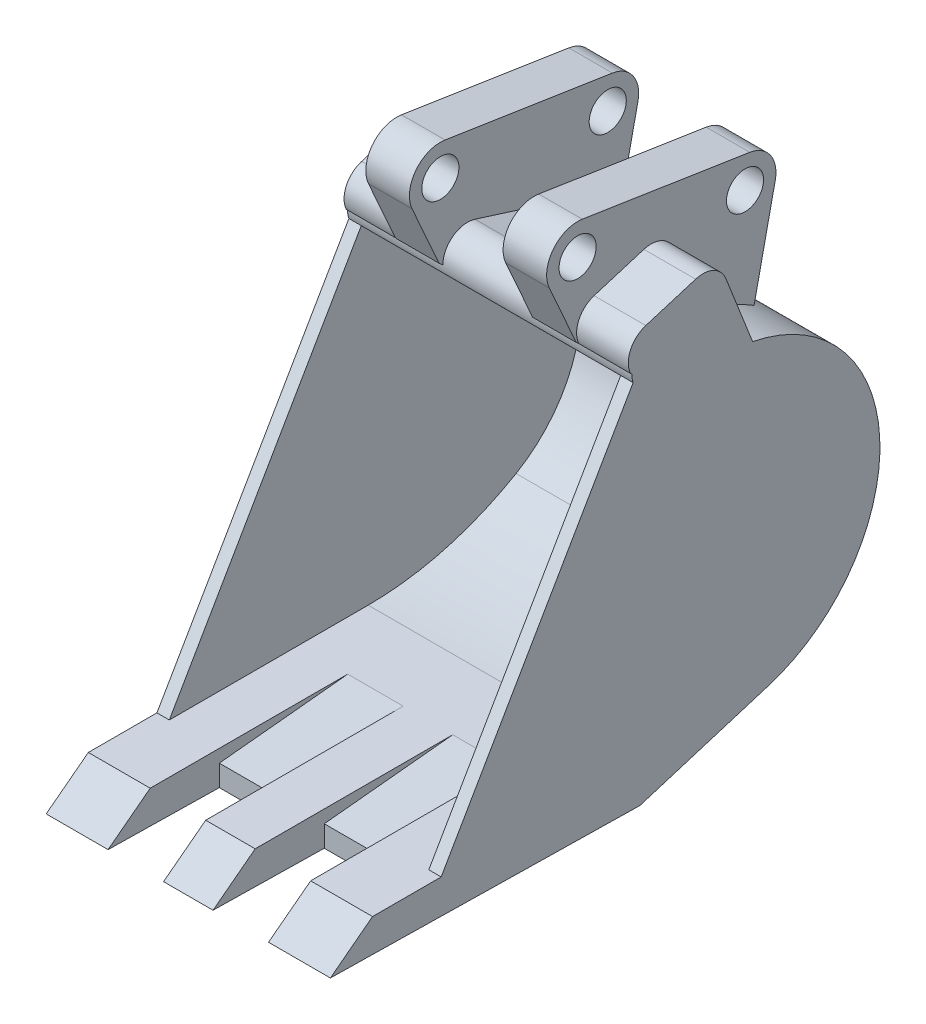
from build123d import *
from build123d.topology import SkipClean

# Parameters (mm, degrees)
BOSS_EXTRUDE1_DEPTH   = 9.600009513678287
BOSS_EXTRUDE2_DEPTH   = 514.3999904863157
CUT_EXTRUDE1_DEPTH    = 199.99999999999986
CUT_EXTRUDE2_DEPTH    = 224.00000000000003
BOSS_EXTRUDE3_DEPTH   = 100.00000000000634
BOSS_EXTRUDE4_DEPTH   = 223.9999999999994
BOSS_EXTRUDE5_DEPTH   = 41.20000000000044
CUT_EXTRUDE3_DEPTH    = 158.79999999999976
BOSS_EXTRUDE6_DEPTH   = 149.19999048631087
CUT_EXTRUDE4_DEPTH    = 378.3999999999982
BOSS_EXTRUDE7_DEPTH   = 9.600009513685004
BOSS_EXTRUDE8_DEPTH   = 49.99999999999939
BOSS_EXTRUDE9_DEPTH   = 279.08274569611746
BOSS_EXTRUDE10_START  = 50.00000000000021
BOSS_EXTRUDE10_DEPTH  = 50.00000000000021
DRAFT1_START          = -793
DRAFT1_DEPTH          = 1150
DRAFT1_START_2        = -791.766847587
DRAFT1_2_DEPTH        = 1148
DRAFT2_ANGLE          = 52.67292498717598
HOLE1_AT_2_COUNT      = 2
HOLE1_AT_2_PITCH      = 684.016470632103
HOLE2_D               = 150
HOLE2_DEPTH           = 384.8
FILLET1_R             = 100.00000000000001
FILLET2_R             = 125
FILLET3_R             = 300
BODY_MOVE_COPY3_ANGLE = 90.0000000000002
BODY_MOVE_COPY4_ANGLE = 120.00000000000021


with BuildPart() as part:
    # Sketch1 → Boss-Extrude1 (new body)
    with BuildSketch(Plane.XY.offset(306.2331524125839)):
        with BuildLine():
            Line((53.08147760316467, -1766.447394034807), (-1027.2936921096916, -1766.4473940348073))
            Line((-1027.2936921096916, -1766.4473940348073), (-1027.2936921096916, -1904.0857327222143))
            Line((-1027.2936921096916, -1904.0857327222143), (98.25366379894766, -1904.0857327222143))
            Line((98.25366379894766, -1904.0857327222143), (571.5107857447487, -1758.657947920252))
            ThreePointArc((571.5107857447487, -1758.657947920252), (1016.6806746482655, -1231.839040201803), (722.5590166804343, -607.9745983313888))
            Line((722.5590166804343, -607.9745983313888), (836.1992361834356, -83.77870158177328))
            Line((836.1992361834356, -83.77870158177328), (28.832182943648764, 40.41985585796329))
            ThreePointArc((28.832182943648764, 40.41985585796329), (-89.48849099605702, -7.222499827583533), (-104.39684181466816, -133.9005050719176))
            Line((-104.39684181466816, -133.9005050719176), (4.335247948888093, -378.51123875566793))
            Line((4.335247948888093, -378.51123875566793), (19.856318658240184, -392.340008322466))
            ThreePointArc((19.856318658240184, -392.340008322466), (21.14387371916233, -408.89399605142665), (25.152813367140993, -425.0067459925245))
            Line((25.152813367140993, -425.0067459925245), (25.121496409919185, -425.06093181631854))
            Line((25.121496409919185, -425.06093181631854), (632.4957363404607, -682.8760006812848))
            ThreePointArc((632.4957363404607, -682.8760006812848), (912.0062760274534, -1138.4665882307247), (650.5429820351718, -1604.6488177874323))
            ThreePointArc((650.5429820351718, -1604.6488177874323), (362.57260370932397, -1725.2821339957313), (53.08147760316467, -1766.447394034807))
        make_face()
    extrude(amount=-BOSS_EXTRUDE1_DEPTH)

    # Sketch2 → Boss-Extrude2 (add)
    with SkipClean():  # the faces are left unmerged after this step: merging them gives an invalid solid
        with BuildSketch(Plane(origin=(0, 0, 296.6331428989056), x_dir=(-1, 0, 0), z_dir=(0, 0, -1))):
            with BuildLine():
                Line((-53.08147763303338, -1766.4473939156126), (1027.293692098456, -1766.4473939156126))
                Line((1027.293692098456, -1766.4473939156126), (1027.293692098456, -1904.0857326059793))
                Line((1027.293692098456, -1904.0857326059793), (-98.2536638101782, -1904.0857326059797))
                Line((-98.2536638101782, -1904.0857326059797), (-571.5107857559829, -1758.6579478040192))
                ThreePointArc((-571.5107857559829, -1758.6579478040192), (-1016.6806746151524, -1231.8390401398947), (-722.5590166804387, -607.9745983313868))
                Line((-722.5590166804387, -607.9745983313868), (-836.1992361834398, -83.77870158177345))
                Line((-836.1992361834398, -83.77870158177345), (-28.832182943652366, 40.41985585796323))
                ThreePointArc((-28.832182943652366, 40.41985585796323), (89.4884909960535, -7.222499827583732), (104.39684181466478, -133.90050507191813))
                Line((104.39684181466478, -133.90050507191813), (-4.335247948891731, -378.51123875566793))
                Line((-4.335247948891731, -378.51123875566793), (-19.856318658241946, -392.340008322466))
                ThreePointArc((-19.856318658241946, -392.340008322466), (-21.14387371916395, -408.8939960514259), (-25.152813367143864, -425.0067459925226))
                Line((-25.152813367143864, -425.0067459925226), (-25.121496409920812, -425.0609318163162))
                Line((-25.121496409920812, -425.0609318163162), (-632.4957363404753, -682.8760006812888))
                ThreePointArc((-632.4957363404753, -682.8760006812888), (-912.0062759939467, -1138.4665881761014), (-650.5429820330173, -1604.6488176769096))
                ThreePointArc((-650.5429820330173, -1604.6488176769096), (-362.57260372260464, -1725.282133878744), (-53.08147763303338, -1766.4473939156126))
            make_face()
        extrude(amount=BOSS_EXTRUDE2_DEPTH)

    # Sketch3 → Cut-Extrude1 (cut)
    with SkipClean():  # the faces are left unmerged after this step: merging them gives an invalid solid
        with BuildSketch(Plane.XY.offset(306.2331524125839)):
            Polygon((-1027.29369209846, -1904.085732605916), (-748.21094640232, -1904.0857326059318), (-748.2109464023167, -1766.44739383907), (-1027.2936920984598, -1766.4473938390806), align=None)
        extrude(amount=-CUT_EXTRUDE1_DEPTH, mode=Mode.SUBTRACT)

    # Sketch4 → Cut-Extrude2 (cut)
    with SkipClean():  # the faces are left unmerged after this step: merging them gives an invalid solid
        with BuildSketch(Plane.XY.offset(106.23315241258402)):
            Polygon((-229.4181464023195, -1766.4473938390802), (-1027.2936920984598, -1766.4473938390806), (-1027.29369209846, -1904.085732605916), (-748.21094640232, -1904.0857326059318), (-748.2109464023184, -1818.3266738390705), align=None)
        extrude(amount=-CUT_EXTRUDE2_DEPTH, mode=Mode.SUBTRACT)

    # Sketch5 → Boss-Extrude3 (add)
    with BuildSketch(Plane(origin=(0, 0, -217.7668475874101), x_dir=(-1, 0, 0), z_dir=(0, 0, -1))):
        with BuildLine():
            Line((-53.081477633029785, -1766.4473939156126), (1027.2936920984594, -1766.4473939156126))
            Line((1027.2936920984594, -1766.4473939156126), (1027.2936920984594, -1904.0857326059793))
            Line((1027.2936920984594, -1904.0857326059793), (-98.2536638101746, -1904.0857326059797))
            Line((-98.2536638101746, -1904.0857326059797), (-571.5107857559792, -1758.6579478040192))
            ThreePointArc((-571.5107857559792, -1758.6579478040192), (-1016.6806746151486, -1231.8390401398945), (-722.5590166804352, -607.9745983313868))
            Line((-722.5590166804352, -607.9745983313868), (-836.1992361834363, -83.77870158177345))
            Line((-836.1992361834363, -83.77870158177345), (-28.832182943648775, 40.41985585796323))
            ThreePointArc((-28.832182943648775, 40.41985585796323), (89.4884909960571, -7.222499827583732), (104.39684181466838, -133.90050507191813))
            Line((104.39684181466838, -133.90050507191813), (-4.3352479488881395, -378.51123875566793))
            Line((-4.3352479488881395, -378.51123875566793), (-19.856318658238703, -392.340008322466))
            ThreePointArc((-19.856318658238703, -392.340008322466), (-21.14387371916071, -408.89399605142586), (-25.152813367140272, -425.0067459925226))
            Line((-25.152813367140272, -425.0067459925226), (-25.12149640991722, -425.0609318163162))
            Line((-25.12149640991722, -425.0609318163162), (-632.4957363404717, -682.8760006812888))
            ThreePointArc((-632.4957363404717, -682.8760006812888), (-912.0062759939432, -1138.4665881761014), (-650.5429820330137, -1604.6488176769096))
            ThreePointArc((-650.5429820330137, -1604.6488176769096), (-362.57260372260106, -1725.282133878744), (-53.081477633029785, -1766.4473939156126))
        make_face()
    extrude(amount=BOSS_EXTRUDE3_DEPTH)

    # Sketch6 → Boss-Extrude4 (add)
    with SkipClean():  # the faces are left unmerged after this step: merging them gives an invalid solid
        with BuildSketch(Plane(origin=(0, 0, -317.76684758741646), x_dir=(-1, 0, 0), z_dir=(0, 0, -1))):
            with BuildLine():
                Line((-53.081477633029195, -1766.4473939156128), (229.4181463204047, -1766.4473939156128))
                Line((229.4181463204047, -1766.4473939156128), (748.2109463203855, -1818.3266739156131))
                Line((748.2109463203855, -1818.3266739156131), (748.2109463203855, -1904.0857326059795))
                Line((748.2109463203855, -1904.0857326059795), (-98.2536638101739, -1904.0857326059797))
                Line((-98.2536638101739, -1904.0857326059797), (-571.5107857559785, -1758.6579478040192))
                ThreePointArc((-571.5107857559785, -1758.6579478040192), (-1016.6806746151481, -1231.8390401398947), (-722.5590166804345, -607.9745983313868))
                Line((-722.5590166804345, -607.9745983313868), (-836.1992361834356, -83.77870158177345))
                Line((-836.1992361834356, -83.77870158177345), (-28.83218294364808, 40.41985585796323))
                ThreePointArc((-28.83218294364808, 40.41985585796323), (89.48849099605779, -7.222499827583732), (104.39684181466907, -133.90050507191813))
                Line((104.39684181466907, -133.90050507191813), (-4.335247948887441, -378.51123875566793))
                Line((-4.335247948887441, -378.51123875566793), (-19.856318658238788, -392.340008322466))
                ThreePointArc((-19.856318658238788, -392.340008322466), (-21.14387371916078, -408.89399605142575), (-25.152813367139576, -425.0067459925226))
                Line((-25.152813367139576, -425.0067459925226), (-25.121496409916524, -425.0609318163162))
                Line((-25.121496409916524, -425.0609318163162), (-632.4957363404711, -682.8760006812888))
                ThreePointArc((-632.4957363404711, -682.8760006812888), (-912.0062759939424, -1138.4665881761016), (-650.5429820330128, -1604.6488176769099))
                ThreePointArc((-650.5429820330128, -1604.6488176769099), (-362.5726037226002, -1725.282133878744), (-53.081477633029195, -1766.4473939156128))
            make_face()
        extrude(amount=BOSS_EXTRUDE4_DEPTH)

    # Sketch7 → Boss-Extrude5 (add)
    with BuildSketch(Plane(origin=(0, 0, -541.7668475874159), x_dir=(-1, 0, 0), z_dir=(0, 0, -1))):
        with BuildLine():
            Line((-722.5590166804329, -607.9745983313868), (-836.1992361834341, -83.77870158177345))
            Line((-836.1992361834341, -83.77870158177345), (-28.83218294364651, 40.41985585796323))
            ThreePointArc((-28.83218294364651, 40.41985585796323), (89.48849099605935, -7.222499827583732), (104.39684181467064, -133.90050507191813))
            Line((104.39684181467064, -133.90050507191813), (-4.335247948885877, -378.51123875566793))
            Line((-4.335247948885877, -378.51123875566793), (-19.856318658237367, -392.340008322466))
            ThreePointArc((-19.856318658237367, -392.340008322466), (-21.14387371915936, -408.89399605142575), (-25.15281336713801, -425.0067459925226))
            Line((-25.15281336713801, -425.0067459925226), (-25.12149640991496, -425.0609318163162))
            Line((-25.12149640991496, -425.0609318163162), (-632.4957363404695, -682.8760006812888))
            ThreePointArc((-632.4957363404695, -682.8760006812888), (-912.0062759939407, -1138.4665881761018), (-650.5429820330108, -1604.6488176769099))
            ThreePointArc((-650.5429820330108, -1604.6488176769099), (-362.57260372259833, -1725.282133878744), (-53.081477633027575, -1766.4473939156126))
            Line((-53.081477633027575, -1766.4473939156126), (1027.2936920984582, -1766.4473939156126))
            Line((1027.2936920984582, -1766.4473939156126), (1027.2936920984582, -1904.0857326059793))
            Line((1027.2936920984582, -1904.0857326059793), (-98.25366381017234, -1904.0857326059797))
            Line((-98.25366381017234, -1904.0857326059797), (-571.510785755977, -1758.6579478040192))
            ThreePointArc((-571.510785755977, -1758.6579478040192), (-1016.6806746151462, -1231.8390401398947), (-722.5590166804329, -607.9745983313868))
        make_face()
    extrude(amount=BOSS_EXTRUDE5_DEPTH)

    # Sketch8 → Cut-Extrude3 (cut)
    with BuildSketch(Plane.XY.offset(306.2331524125839)):
        with BuildLine():
            Line((-104.39684181466816, -133.9005050719176), (4.335247948888093, -378.51123875566793))
            Line((4.335247948888093, -378.51123875566793), (14.489613985965955, -387.5584488775228))
            ThreePointArc((14.489613985965955, -387.5584488775228), (14.590003133143597, -305.2236767235862), (76.43568070724513, -250.87170390730495))
            Line((76.43568070724513, -250.87170390730495), (365.9318713497288, -162.3638362624787))
            Line((365.9318713497288, -162.3638362624787), (507.9668142543914, -522.9405451781555))
            ThreePointArc((507.9668142543914, -522.9405451781555), (619.1405258320616, -555.6720221138472), (722.5590166804343, -607.9745983313888))
            Line((722.5590166804343, -607.9745983313888), (836.1992361834356, -83.77870158177328))
            Line((836.1992361834356, -83.77870158177328), (28.832182943648764, 40.41985585796329))
            ThreePointArc((28.832182943648764, 40.41985585796329), (-89.48849099605702, -7.222499827583533), (-104.39684181466816, -133.9005050719176))
        make_face()
    extrude(amount=-CUT_EXTRUDE3_DEPTH, mode=Mode.SUBTRACT)

    # Sketch9 → Boss-Extrude6 (add)
    with BuildSketch(Plane(origin=(0, 0, -582.9668475874164), x_dir=(-1, 0, 0), z_dir=(0, 0, -1))):
        with BuildLine():
            Line((-25.1528133969194, -425.00674593665815), (-25.121496439696347, -425.0609317604518))
            Line((-25.121496439696347, -425.0609317604518), (-632.4957363702508, -682.8760006254245))
            ThreePointArc((-632.4957363702508, -682.8760006254245), (-912.0062760572353, -1138.4665881748622), (-650.5429820649566, -1604.6488177315662))
            ThreePointArc((-650.5429820649566, -1604.6488177315662), (-362.5726037391466, -1725.2821339398504), (-53.08147763302735, -1766.4473939789204))
            Line((-53.08147763302735, -1766.4473939789204), (1027.2936920984585, -1766.4473939789204))
            Line((1027.2936920984585, -1766.4473939789204), (1027.2936920984585, -1904.0857326059793))
            Line((1027.2936920984585, -1904.0857326059793), (-98.25366381017204, -1904.0857326059797))
            Line((-98.25366381017204, -1904.0857326059797), (-571.5107857559767, -1758.6579478040192))
            ThreePointArc((-571.5107857559767, -1758.6579478040192), (-1021.2655844178603, -1116.037821102927), (-507.96681425438925, -522.9405451781541))
            Line((-507.96681425438925, -522.9405451781541), (-365.93187134972715, -162.36383626247863))
            Line((-365.93187134972715, -162.36383626247863), (-76.43568075553172, -250.8717038925416))
            ThreePointArc((-76.43568075553172, -250.8717038925416), (-14.59000319073344, -305.2236766882949), (-14.48961401574584, -387.55844882165815))
            Line((-14.48961401574584, -387.55844882165815), (-19.856318688019385, -392.3400082666016))
            ThreePointArc((-19.856318688019385, -392.3400082666016), (-21.143873748941374, -408.89399599556117), (-25.1528133969194, -425.00674593665815))
        make_face()
    extrude(amount=BOSS_EXTRUDE6_DEPTH)

    # Sketch10 → Cut-Extrude4 (cut)
    with BuildSketch(Plane.XY.offset(-28.56684758741631)):
        with BuildLine():
            Line((149.86368907718216, -297.4981497888479), (422.5993383847587, -383.2974405420883))
            Line((422.5993383847587, -383.2974405420883), (537.0574725944384, -529.407137109236))
            ThreePointArc((537.0574725944384, -529.407137109236), (632.9288557363569, -561.3229552494635), (722.5590166804348, -607.9745983313883))
            Line((722.5590166804348, -607.9745983313883), (836.1992361834361, -83.77870158177348))
            Line((836.1992361834361, -83.77870158177348), (28.832182943648167, 40.41985585796329))
            ThreePointArc((28.832182943648167, 40.41985585796329), (-89.48849099605714, -7.222499827583846), (-104.39684181466868, -133.90050507191796))
            Line((-104.39684181466868, -133.90050507191796), (4.335247948887403, -378.5112387556677))
            Line((4.335247948887403, -378.5112387556677), (19.85631865823901, -392.34000832246596))
            ThreePointArc((19.85631865823901, -392.34000832246596), (60.919413328362104, -312.1017843461267), (149.86368907718216, -297.4981497888479))
        make_face()
    extrude(amount=-CUT_EXTRUDE4_DEPTH, mode=Mode.SUBTRACT)

    # Sketch11 → Boss-Extrude7 (add)
    with BuildSketch(Plane(origin=(0, 0, -732.1668380737271), x_dir=(-1, 0, 0), z_dir=(0, 0, -1))):
        with BuildLine():
            Line((-25.152813396918305, -425.00674593665826), (-25.121496439695253, -425.0609317604519))
            Line((-25.121496439695253, -425.0609317604519), (-632.4957363702498, -682.8760006254246))
            ThreePointArc((-632.4957363702498, -682.8760006254246), (-912.006276057234, -1138.4665881748624), (-650.5429820649556, -1604.6488177315662))
            ThreePointArc((-650.5429820649556, -1604.6488177315662), (-362.5726037391455, -1725.2821339398504), (-53.08147763302631, -1766.4473939789204))
            Line((-53.08147763302631, -1766.4473939789204), (1027.2936920984596, -1766.4473939789204))
            Line((1027.2936920984596, -1766.4473939789204), (1027.2936920984596, -1904.0857326059793))
            Line((1027.2936920984596, -1904.0857326059793), (-98.253663810171, -1904.0857326059797))
            Line((-98.253663810171, -1904.0857326059797), (-571.5107857559757, -1758.6579478040192))
            ThreePointArc((-571.5107857559757, -1758.6579478040192), (-1021.2655844178593, -1116.037821102927), (-507.9668142543883, -522.9405451781541))
            Line((-507.9668142543883, -522.9405451781541), (-365.9318713497261, -162.36383626247863))
            Line((-365.9318713497261, -162.36383626247863), (-76.43568075553054, -250.87170389254166))
            ThreePointArc((-76.43568075553054, -250.87170389254166), (-14.590003190732247, -305.223676688295), (-14.489614015744714, -387.55844882165826))
            Line((-14.489614015744714, -387.55844882165826), (-19.856318688018295, -392.3400082666017))
            ThreePointArc((-19.856318688018295, -392.3400082666017), (-21.14387374894028, -408.8939959955613), (-25.152813396918305, -425.00674593665826))
        make_face()
    extrude(amount=BOSS_EXTRUDE7_DEPTH)

    # Sketch12 → Boss-Extrude8 (add)
    with SkipClean():  # the faces are left unmerged after this step: merging them gives an invalid solid
        with BuildSketch(Plane(origin=(0, 0, -741.7668475874121), x_dir=(-1, 0, 0), z_dir=(0, 0, -1))):
            with BuildLine():
                Line((-365.93187134972607, -162.36383626247863), (-76.4356807072422, -250.8717039073049))
                ThreePointArc((-76.4356807072422, -250.8717039073049), (-14.590003133141124, -305.2236767235862), (-14.489613985962942, -387.55844887752255))
                Line((-14.489613985962942, -387.55844887752255), (-19.85631865823669, -392.3400083224661))
                ThreePointArc((-19.85631865823669, -392.3400083224661), (-21.143873719158677, -408.89399605142563), (-25.152813367136616, -425.0067459925226))
                Line((-25.152813367136616, -425.0067459925226), (750.1392546412519, -1766.4473938390702))
                Line((750.1392546412519, -1766.4473938390702), (1027.293692098458, -1766.4473938390702))
                Line((1027.293692098458, -1766.4473938390702), (1027.2936920984596, -1904.0857326059793))
                Line((1027.2936920984596, -1904.0857326059793), (-98.25366381017093, -1904.0857326059797))
                Line((-98.25366381017093, -1904.0857326059797), (-571.5107857559756, -1758.6579478040192))
                ThreePointArc((-571.5107857559756, -1758.6579478040192), (-1021.2655844178594, -1116.037821102927), (-507.96681425438817, -522.9405451781541))
                Line((-507.96681425438817, -522.9405451781541), (-365.93187134972607, -162.36383626247863))
            make_face()
        extrude(amount=BOSS_EXTRUDE8_DEPTH)

    # Sketch13 → Boss-Extrude9 (add)
    with BuildSketch(Plane.ZY.offset(748.2109464022755)):
        Polygon((306.2331524125839, -1904.0857326059336), (106.23315241258402, -1904.0857326059336), (106.23315241258602, -1766.4473938391052), (306.23315241258393, -1766.4473938390927), align=None)
    extrude(amount=BOSS_EXTRUDE9_DEPTH)

    # Sketch14 → Boss-Extrude10 (add)
    with BuildSketch(Plane.XY.offset(306.2331524125839).offset(BOSS_EXTRUDE10_START)):
        with BuildLine():
            Line((19.85631865824079, -392.3400083224026), (14.48961398596682, -387.5584488774589))
            ThreePointArc((14.48961398596682, -387.5584488774589), (14.590003133144805, -305.22367672352243), (76.43568070724626, -250.8717039072411))
            Line((76.43568070724626, -250.8717039072411), (365.93187134972885, -162.3638362624152))
            Line((365.93187134972885, -162.3638362624152), (507.9668142543918, -522.9405451780918))
            ThreePointArc((507.9668142543918, -522.9405451780918), (1021.265584417858, -1116.0378211028633), (571.51078575598, -1758.6579478039534))
            Line((571.51078575598, -1758.6579478039534), (98.25366381017913, -1904.0857326059158))
            Line((98.25366381017913, -1904.0857326059158), (-1027.2936920984382, -1904.085732605916))
            Line((-1027.2936920984382, -1904.085732605916), (-1027.2936920984382, -1766.4473938390063))
            Line((-1027.2936920984382, -1766.4473938390063), (-750.1392546412476, -1766.4473938390065))
            Line((-750.1392546412476, -1766.4473938390065), (25.152813367141405, -425.006745992461))
            ThreePointArc((25.152813367141405, -425.006745992461), (21.14387371916291, -408.89399605136316), (19.85631865824079, -392.3400083224026))
        make_face()
    extrude(amount=-BOSS_EXTRUDE10_DEPTH)

    # Draft1: read off the stored shape, not the designer's step
    # Draft1 outline → Draft1 (cut)
    with BuildSketch(Plane.XY.offset(DRAFT1_START)):
        Polygon((-748.210939686, -1904.085732722), (-1027.293692098, -1899.215067885), (-1027.29369211, -1904.085732606), align=None)
    extrude(amount=DRAFT1_DEPTH, mode=Mode.SUBTRACT)

    # Draft1 2 outline → Draft1 2 (add)
    with BuildSketch(Plane.XY.offset(DRAFT1_START_2)):
        Polygon((98.25366381, -1904.085732722), (-748.210939686, -1904.085732722), (52.762887679, -1918.064651242), align=None)
    extrude(amount=DRAFT1_2_DEPTH)

    # Draft2
    draft2_faces = [part.faces().sort_by_distance(p)[0] for p in [
        (-1027.2936920984582, -1832.831230907224, -666.7668475977032),
        (-1027.2936920984357, -1832.831230862022, 231.23315241259633),
        (-1027.293692098456, -1832.831230881173, -217.766847577809),
    ]]
    draft(draft2_faces, Plane(origin=(53.08147760316467, -1766.447394034807, 296.6331428989056), x_dir=(1, 2.1e-16, 0), z_dir=(-2.1e-16, 1, 0)), DRAFT2_ANGLE)

    # Sketch15 → Hole1 (revolve, cut)
    with BuildSketch(Plane(origin=(9.826792637787367, -83.1268767549308, -406.9668475874145), x_dir=(0, -1, 0), z_dir=(1, 0, 0))):
        Polygon((0, 0), (0, 384.79999999999706), (74.99999999999999, 384.79999999999706), (75.00000000000003, 7.96e-15), align=None)
    hole1 = revolve(axis=Axis((9.826792637787367, -83.1268767549308, -516.9668475874146), (0, 0, 1)), mode=Mode.SUBTRACT)

    # Hole1 at 2: Hole1 ×2
    with Locations(*[Vector(0.9883738609031518, -0.15204312244688098, 0) * (i * HOLE1_AT_2_PITCH) for i in range(1, HOLE1_AT_2_COUNT)]):
        add(hole1, mode=Mode.SUBTRACT)

    # Hole2
    with Locations(Plane(origin=(0, 0, -28.56684758741631), x_dir=(-1, 0, 0), z_dir=(0, 0, -1))):
        with Locations((-685.890792638, -187.126876755), (-9.826792638, -83.126876755)):
            Hole(HOLE2_D / 2, depth=HOLE2_DEPTH)

    # Fillet1
    fillet1_edges = [part.edges().sort_by_distance(p)[0] for p in [
        (365.9318713497288, -162.36383626244697, 251.83315241258413),
        (365.93187134972663, -162.36383626247863, -687.366847587414),
    ]]
    fillet(fillet1_edges, radius=FILLET1_R)

    # Fillet2
    fillet2_edges = [part.edges().sort_by_distance(p)[0] for p in [
        (836.1992361834342, -83.77870158177343, -494.9668475874155),
        (836.1992361834351, -83.77870158177332, 59.43315241258392),
    ]]
    fillet(fillet2_edges, radius=FILLET2_R)

    # Fillet3
    fillet3_edges = [part.edges().sort_by_distance(p)[0] for p in [
        (422.5993383847587, -383.2974405420883, -217.7668475874154),
    ]]
    fillet(fillet3_edges, radius=FILLET3_R)


with BuildPart() as part_1:
    # Body-Move/Copy1: read off the stored shape, not the designer's step
    # Body-Move/Copy1: moved
    add(part.part.moved(Location((-9.8267926, 83.1268768, 0))))


with BuildPart() as part_2:
    # Body-Move/Copy2: read off the stored shape, not the designer's step
    # Body-Move/Copy2: moved
    add(part_1.part.moved(Location((0, 0, 222.7668476))))


with BuildPart() as part_3:
    # Body-Move/Copy3: moved
    add(part_2.part.rotate(Axis((0, 0, 0), (0, 0, -1)), BODY_MOVE_COPY3_ANGLE))


with BuildPart() as part_4:
    # Body-Move/Copy4: moved
    add(part_3.part.rotate(Axis((0, 0, 0), (0.5773502691896252, 0.5773502691896252, 0.5773502691896272)), BODY_MOVE_COPY4_ANGLE))


solid = part_4.part
